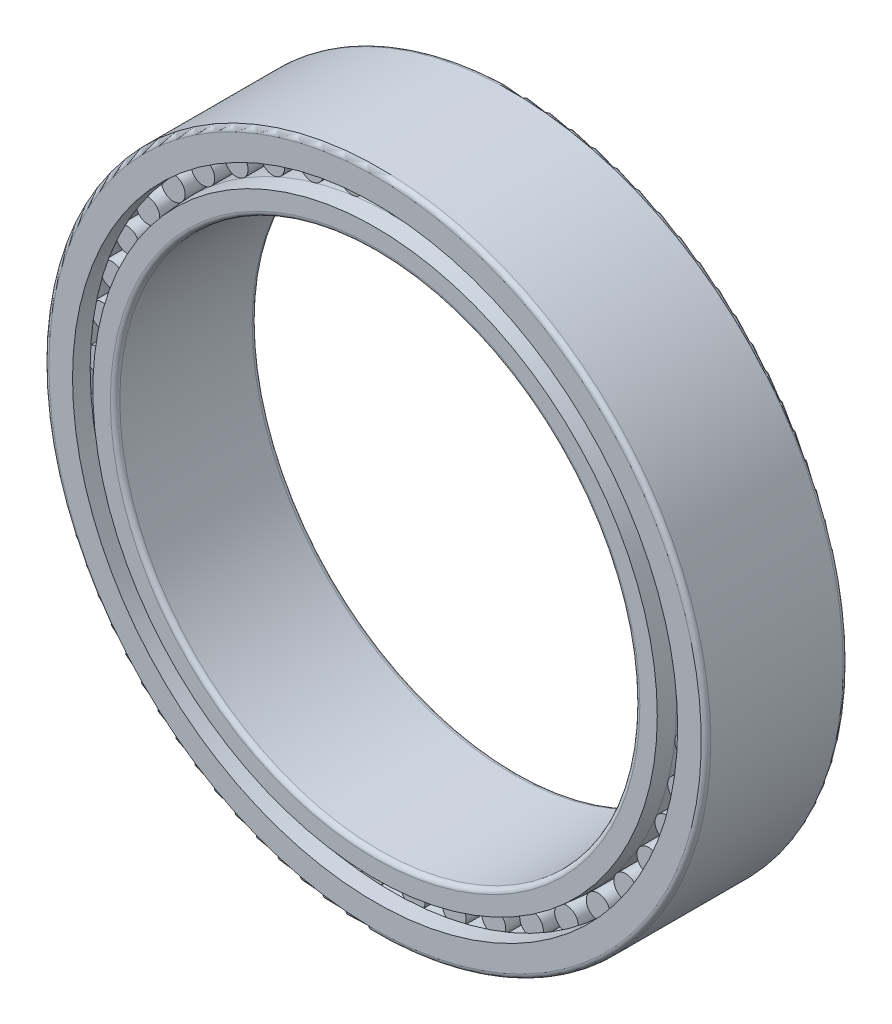
from build123d import *

# Parameters (mm, degrees)
BASESKE_W            = 22.5
BASESKE_H            = 2.5
FILLET1_R            = 1
CIRPATTERNBALL_COUNT = 45


with BuildPart() as part:
    # BaseSke → Roller (revolve)
    with BuildSketch(Plane(origin=(0, 0, 0), x_dir=(0, 0, -1), z_dir=(1, 0, 0))):
        with Locations((0, 61.25)):
            Rectangle(BASESKE_W, BASESKE_H)
    roller = revolve(axis=Axis((0, 62.5, 11.25), (0, 0, -1)))

    # OuterRaceSke → OuterRace (revolve)
    with BuildSketch(Plane(origin=(0, 0, 0), x_dir=(0, 0, -1), z_dir=(1, 0, 0))):
        Polygon((-15, 70), (15, 70), (15, 64), (11.275, 64), (11.275, 64.98), (-11.275, 64.98), (-11.275, 64), (-15, 64), align=None)
    revolve(axis=Axis((0, 0, 50.391616343), (0, 0, -1)))

    # InnerRaceSke → InnerRace (revolve)
    with BuildSketch(Plane(origin=(0, 0, 0), x_dir=(0, 0, -1), z_dir=(1, 0, 0))):
        Polygon((-15, 55), (15, 55), (15, 59.694104728), (11.275, 60.02), (-11.275, 60.02), (-15, 59.694104728), align=None)
    revolve(axis=Axis((0, 0, 70.862590906), (0, 0, -1)))

    # Fillet1
    fillet1_edges = [part.edges().sort_by_distance(p)[0] for p in [
        (0, -55, 15),
        (0, -70, -15),
        (0, -70, 15),
        (0, -55, -15),
    ]]
    fillet(fillet1_edges, radius=FILLET1_R)

    # CirPatternBall: Roller ×45 about axis
    cirpatternball_axis = Axis((0, 0, 50.391616343), (0, 0, -1))
    for i in range(1, CIRPATTERNBALL_COUNT):
        add(roller.rotate(cirpatternball_axis, i * 360 / CIRPATTERNBALL_COUNT))


solid = part.part
